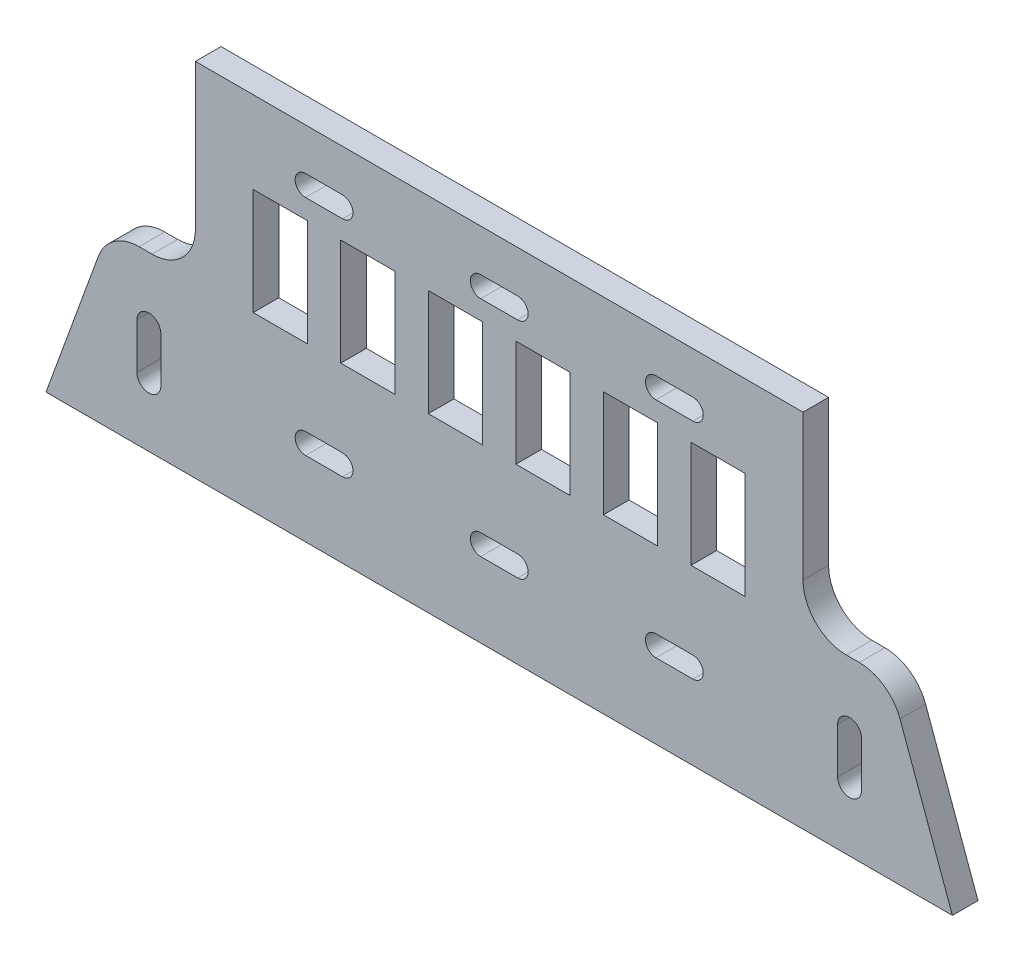
from build123d import *

# Parameters (mm, degrees)
SKETCH1_W                           = 198.43248
SKETCH1_H                           = 59.281
SKETCH1_R                           = 1.5
BOSS_EXTRUDE1_DEPTH                 = 4.5
SKETCH4_W                           = 9.531640124
SKETCH4_H                           = 18.749999962
SKETCH4_W_2                         = 9.531640123
CUT_EXTRUDE2_DEPTH                  = 149.263073085
CUT_EXTRUDE3_DEPTH                  = 149.263073085
SKETCH6_W                           = 198.43248
SKETCH6_H                           = 4.22
BOSS_EXTRUDE2_DEPTH                 = 4.5
CUT_EXTRUDE4_DEPTH                  = 152.422689452
FILLET1_R                           = 7.62
F_27_0_144_DIAMETER_SLOT1_OUTLINE_R = 1.5
F_27_0_144_DIAMETER_SLOT1_DEPTH     = 4.5


# Read off the part's stored shape, not the designer's step: #27 (0.144) Diameter Slot1
with BuildPart() as part:
    # Sketch1 → Boss-Extrude1 (new body)
    with BuildSketch(Plane.XY):
        with Locations((0, 80.4405)):
            Rectangle(SKETCH1_W, SKETCH1_H)
        with Locations((46.2, 105.081)):
            Circle(SKETCH1_R, mode=Mode.SUBTRACT)
        with Locations((46.2, 65.8)):
            Circle(SKETCH1_R, mode=Mode.SUBTRACT)
        with Locations((15.4, 65.8)):
            Circle(SKETCH1_R, mode=Mode.SUBTRACT)
        with Locations((15.4, 105.081)):
            Circle(SKETCH1_R, mode=Mode.SUBTRACT)
        with Locations((-15.4, 105.081)):
            Circle(SKETCH1_R, mode=Mode.SUBTRACT)
        with Locations((-15.4, 65.8)):
            Circle(SKETCH1_R, mode=Mode.SUBTRACT)
    extrude(amount=BOSS_EXTRUDE1_DEPTH)

    # Sketch4 → Cut-Extrude2 (cut, through all)
    with BuildSketch(Plane(origin=(0, 0, 4.5), x_dir=(-1, 0, 0), z_dir=(0, 0, -1))):
        with Locations((-53.889258182, 90.503714938)):
            Rectangle(SKETCH4_W, SKETCH4_H)
        with Locations((-38.492327273, 90.503714938)):
            Rectangle(SKETCH4_W, SKETCH4_H)
        with Locations((-23.095396364, 90.503714938)):
            Rectangle(SKETCH4_W_2, SKETCH4_H)
        with Locations((-7.698465454, 90.503714938)):
            Rectangle(SKETCH4_W_2, SKETCH4_H)
        with Locations((7.698465454, 90.503714938)):
            Rectangle(SKETCH4_W_2, SKETCH4_H)
        with Locations((23.095396364, 90.503714938)):
            Rectangle(SKETCH4_W_2, SKETCH4_H)
    extrude(amount=CUT_EXTRUDE2_DEPTH, mode=Mode.SUBTRACT)

    # Sketch5 → Cut-Extrude3 (cut, through all)
    with BuildSketch(Plane(origin=(0, 0, 0), x_dir=(-1, 0, 0), z_dir=(0, 0, -1))):
        with BuildLine():
            Line((-74.899953, 69.8), (-74.899953, 61.8))
            ThreePointArc((-74.899953, 61.8), (-76.999953, 59.7), (-79.099953, 61.8))
            Line((-79.099953, 61.8), (-79.099953, 69.8))
            ThreePointArc((-79.099953, 69.8), (-76.999953, 71.9), (-74.899953, 69.8))
        make_face()
        with BuildLine():
            Line((44.099953, 69.8), (44.099953, 61.8))
            ThreePointArc((44.099953, 61.8), (46.199953, 59.7), (48.299953, 61.8))
            Line((48.299953, 61.8), (48.299953, 69.8))
            ThreePointArc((48.299953, 69.8), (46.199953, 71.9), (44.099953, 69.8))
        make_face()
    extrude(amount=-CUT_EXTRUDE3_DEPTH, mode=Mode.SUBTRACT)

    # Sketch6 → Boss-Extrude2 (add)
    with BuildSketch(Plane(origin=(0, 0, 0), x_dir=(-1, 0, 0), z_dir=(0, 0, -1))):
        with Locations((0, 112.191)):
            Rectangle(SKETCH6_W, SKETCH6_H)
    extrude(amount=-BOSS_EXTRUDE2_DEPTH)

    # Sketch7 → Cut-Extrude4 (cut, through all)
    with BuildSketch(Plane(origin=(0, 0, 0), x_dir=(-1, 0, 0), z_dir=(0, 0, -1))):
        Polygon((-68.815078244, 114.301), (-99.21624, 114.301), (-99.21624, 50.8), (-95.088898012, 50.8), (-84.050148524, 81.128714957), (-68.815078244, 81.128714957), align=None)
        Polygon((99.21624, 114.301), (38.015078244, 114.301), (38.015078244, 81.128714957), (53.250148524, 81.128714957), (64.288898012, 50.8), (99.21624, 50.8), align=None)
    extrude(amount=-CUT_EXTRUDE4_DEPTH, mode=Mode.SUBTRACT)

    # Fillet1
    fillet1_edges = [part.edges().sort_by_distance(p)[0] for p in [
        (84.050148524, 81.128714957, 2.25),
        (68.815078244, 81.128714957, 2.25),
        (-53.250148524, 81.128714957, 2.25),
        (-38.015078244, 81.128714957, 2.25),
    ]]
    fillet(fillet1_edges, radius=FILLET1_R)

    # #27 (0.144) Diameter Slot1 outline → #27 (0.144) Diameter Slot1 (cut)
    # profile 1 of 6: a face of its own
    with BuildSketch(Plane.XY):
        with BuildLine():
            ThreePointArc((49.4512, 103.2522), (51.28, 105.081), (49.4512, 106.9098))
            Line((49.4512, 106.9098), (42.9488, 106.9098))
            ThreePointArc((42.9488, 106.9098), (41.12, 105.081), (42.9488, 103.2522))
            Line((42.9488, 103.2522), (49.4512, 103.2522))
        make_face()
        with Locations((46.2, 105.081)):
            Circle(F_27_0_144_DIAMETER_SLOT1_OUTLINE_R, mode=Mode.SUBTRACT)
    # profile 2 of 6: a face of its own
    with BuildSketch(Plane.XY):
        with BuildLine():
            ThreePointArc((12.1488, 106.9098), (10.32, 105.081), (12.1488, 103.2522))
            Line((12.1488, 103.2522), (18.6512, 103.2522))
            ThreePointArc((18.6512, 103.2522), (20.48, 105.081), (18.6512, 106.9098))
            Line((18.6512, 106.9098), (12.1488, 106.9098))
        make_face()
        with Locations((15.4, 105.081)):
            Circle(F_27_0_144_DIAMETER_SLOT1_OUTLINE_R, mode=Mode.SUBTRACT)
    # profile 3 of 6: a face of its own
    with BuildSketch(Plane.XY):
        with BuildLine():
            ThreePointArc((-18.6512, 106.9098), (-20.48, 105.081), (-18.6512, 103.2522))
            Line((-18.6512, 103.2522), (-12.1488, 103.2522))
            ThreePointArc((-12.1488, 103.2522), (-10.32, 105.081), (-12.1488, 106.9098))
            Line((-12.1488, 106.9098), (-18.6512, 106.9098))
        make_face()
        with Locations((-15.4, 105.081)):
            Circle(F_27_0_144_DIAMETER_SLOT1_OUTLINE_R, mode=Mode.SUBTRACT)
    # profile 4 of 6: a face of its own
    with BuildSketch(Plane.XY):
        with BuildLine():
            ThreePointArc((-12.1488, 63.9712), (-10.32, 65.8), (-12.1488, 67.6288))
            Line((-12.1488, 67.6288), (-18.6512, 67.6288))
            ThreePointArc((-18.6512, 67.6288), (-20.48, 65.8), (-18.6512, 63.9712))
            Line((-18.6512, 63.9712), (-12.1488, 63.9712))
        make_face()
        with Locations((-15.4, 65.8)):
            Circle(F_27_0_144_DIAMETER_SLOT1_OUTLINE_R, mode=Mode.SUBTRACT)
    # profile 5 of 6: a face of its own
    with BuildSketch(Plane.XY):
        with BuildLine():
            ThreePointArc((12.1488, 67.6288), (10.32, 65.8), (12.1488, 63.9712))
            Line((12.1488, 63.9712), (18.6512, 63.9712))
            ThreePointArc((18.6512, 63.9712), (20.48, 65.8), (18.6512, 67.6288))
            Line((18.6512, 67.6288), (12.1488, 67.6288))
        make_face()
        with Locations((15.4, 65.8)):
            Circle(F_27_0_144_DIAMETER_SLOT1_OUTLINE_R, mode=Mode.SUBTRACT)
    # profile 6 of 6: a face of its own
    with BuildSketch(Plane.XY):
        with BuildLine():
            ThreePointArc((42.9488, 67.6288), (41.12, 65.8), (42.9488, 63.9712))
            Line((42.9488, 63.9712), (49.4512, 63.9712))
            ThreePointArc((49.4512, 63.9712), (51.28, 65.8), (49.4512, 67.6288))
            Line((49.4512, 67.6288), (42.9488, 67.6288))
        make_face()
        with Locations((46.2, 65.8)):
            Circle(F_27_0_144_DIAMETER_SLOT1_OUTLINE_R, mode=Mode.SUBTRACT)
    extrude(amount=F_27_0_144_DIAMETER_SLOT1_DEPTH, mode=Mode.SUBTRACT)


solid = part.part
